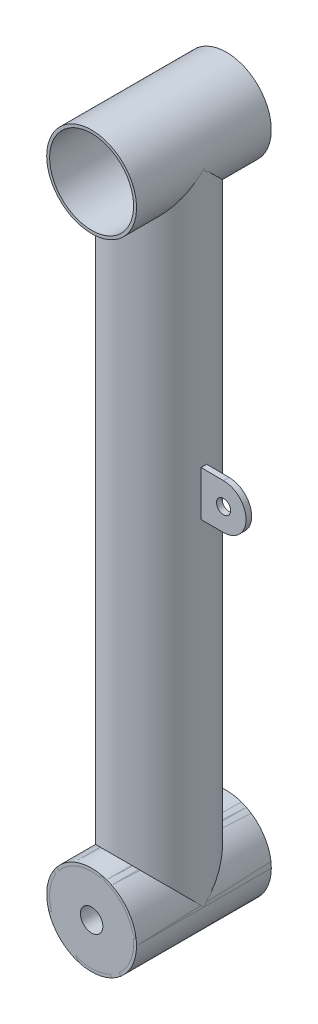
from build123d import *

# Parameters (mm, degrees)
AL_START                                     = -1e-07
AL_ROUND_TUBING_2_OD_X_0_063_WALL_1_OUTL_R   = 25.4
AL_ROUND_TUBING_2_OD_X_0_063_WALL_1_OUTL_R_2 = 23.749
AL_ROUND_TUBING_2_OD_X_0_063_WALL_1_DEPTH    = 361.4420002
AL_START_2                                   = 12
AL_ROUND_TUBING_2_OD_X_0_063_WALL_1_2_DEPTH  = 52
AL_ROUND_TUBING_2_OD_X_0_063_WALL_1_3_OU_R   = 25.4
AL_ROUND_TUBING_2_OD_X_0_063_WALL_1_3_OU_R_2 = 23.749
AL_ROUND_TUBING_2_OD_X_0_063_WALL_1_3_DEPTH  = 76.2
AL_ROUND_TUBING_2_OD_X_0_063_WALL_1_4_OU_R   = 25.4
AL_ROUND_TUBING_2_OD_X_0_063_WALL_1_4_OU_R_2 = 23.749
AL_ROUND_TUBING_2_OD_X_0_063_WALL_1_4_DEPTH  = 76.2
SKETCH13_R                                   = 25.4
SKETCH13_R_2                                 = 6.35
BOSS_EXTRUDE1_DEPTH                          = 76.2
BOSS_EXTRUDE2_DEPTH                          = 1.5875
BOSS_EXTRUDE2_DEPTH_BACK                     = 1.5875
F_3DSKETCH2_R                                = 4


with BuildPart() as part:
    # Al round tubing 2 OD X 0.063 WALL(1): read off the stored shape, not the designer's step
    # Al round tubing 2 OD X 0.063 WALL(1) outl → Al round tubing 2 OD X 0.063 WALL(1) (new body)
    with BuildSketch(Plane(origin=(0, 0, 0), x_dir=(1, 0, 0), z_dir=(0, 1, 0)).offset(AL_START)):
        with Locations((0, -38.1)):
            Circle(AL_ROUND_TUBING_2_OD_X_0_063_WALL_1_OUTL_R)
        with Locations((0, -38.1)):
            Circle(AL_ROUND_TUBING_2_OD_X_0_063_WALL_1_OUTL_R_2, mode=Mode.SUBTRACT)
    extrude(amount=AL_ROUND_TUBING_2_OD_X_0_063_WALL_1_DEPTH)

    # Al round tubing 2 OD X 0.063 WALL_1 2 ou → Al round tubing 2 OD X 0.063 WALL_1 2 (cut)
    with BuildSketch(Plane.XY.offset(AL_START_2)):
        with BuildLine():
            Line((-25.4, 0), (25.4, 0))
            ThreePointArc((25.4, 0), (0, 25.4), (-25.4, 0))
        make_face()
        with BuildLine():
            Line((25.4, 361.442), (-25.4, 361.442))
            ThreePointArc((-25.4, 361.442), (0, 336.042), (25.4, 361.442))
        make_face()
    extrude(amount=AL_ROUND_TUBING_2_OD_X_0_063_WALL_1_2_DEPTH, mode=Mode.SUBTRACT)


with BuildPart() as body_2:
    # Al round tubing 2 OD X 0.063 WALL_1 3 ou → Al round tubing 2 OD X 0.063 WALL_1 3 (new body)
    with BuildSketch(Plane.XY):
        with Locations((0, 361.442)):
            Circle(AL_ROUND_TUBING_2_OD_X_0_063_WALL_1_3_OU_R)
        with Locations((0, 361.442)):
            Circle(AL_ROUND_TUBING_2_OD_X_0_063_WALL_1_3_OU_R_2, mode=Mode.SUBTRACT)
    extrude(amount=AL_ROUND_TUBING_2_OD_X_0_063_WALL_1_3_DEPTH)


with BuildPart() as body_3:
    # Al round tubing 2 OD X 0.063 WALL_1 4 ou → Al round tubing 2 OD X 0.063 WALL_1 4 (new body)
    with BuildSketch(Plane.XY):
        Circle(AL_ROUND_TUBING_2_OD_X_0_063_WALL_1_4_OU_R)
        Circle(AL_ROUND_TUBING_2_OD_X_0_063_WALL_1_4_OU_R_2, mode=Mode.SUBTRACT)
    extrude(amount=AL_ROUND_TUBING_2_OD_X_0_063_WALL_1_4_DEPTH)


with BuildPart() as body_4:
    # Sketch13 → Boss-Extrude1 (new body)
    with BuildSketch(Plane.XY.offset(76.2)):
        Circle(SKETCH13_R)
        Circle(SKETCH13_R_2, mode=Mode.SUBTRACT)
    extrude(amount=-BOSS_EXTRUDE1_DEPTH)


with BuildPart() as body_5:
    # 3DSketch2 → Boss-Extrude2 (new, two sides: drawn at the far end of the back side and taken through both)
    with BuildSketch(Plane(origin=(38.1, 190.5, 38.1), x_dir=(-0.4456040206434466, 0.895230169725303, 0), z_dir=(0, 0, 1)).offset(-BOSS_EXTRUDE2_DEPTH_BACK)):
        with BuildLine():
            Line((0, 0), (5.659171062, 11.369423156))
            Line((5.659171062, 11.369423156), (28.500640505, 0))
            Line((28.500640505, 0), (22.738846311, -11.318342124))
            ThreePointArc((22.738846311, -11.318342124), (5.710252093, -17.028594218), (0, 0))
        make_face()
        with Locations(Location((11.369423156, -5.659171062, 0), (0, 0, 243.538009692))):
            Circle(F_3DSKETCH2_R, mode=Mode.SUBTRACT)
    extrude(amount=BOSS_EXTRUDE2_DEPTH + BOSS_EXTRUDE2_DEPTH_BACK)


solid = Compound([part.part, body_2.part, body_3.part, body_4.part, body_5.part])
